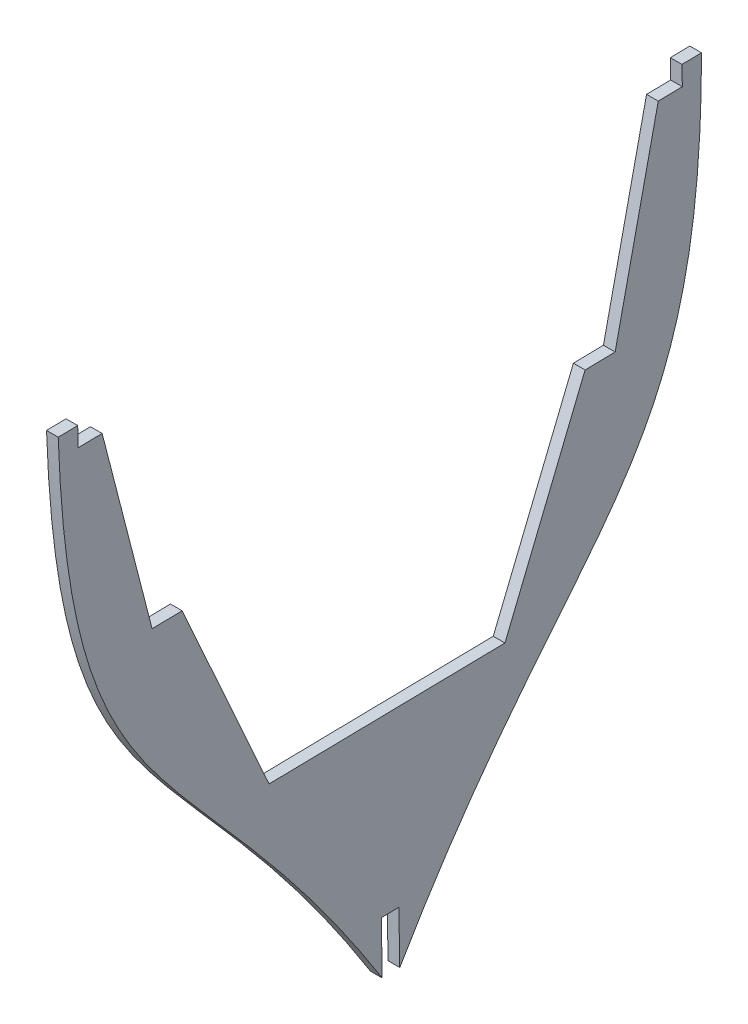
from build123d import *

# Parameters (mm, degrees)
BOSS_EXTRU_3_DEPTH      = 6
ENL_V_MAT_EXTRU_1_DEPTH = 6


with BuildPart() as part:
    # Esquisse2 → Boss.-Extru.3 (new body)
    with BuildSketch(Plane(origin=(0, 0, 0), x_dir=(0, 0, -1), z_dir=(1, 0, 0))):
        with BuildLine():
            Line((158.688577112, 362.336280449), (148.690113904, 362.160970799))
            Line((148.690113904, 362.160970799), (148.865423553, 352.162507591))
            Line((148.865423553, 352.162507591), (136.516792043, 351.945990891))
            Line((136.516792043, 351.945990891), (114.39634214, 251.542768174))
            Line((114.39634214, 251.542768174), (98.982631034, 251.272509411))
            Line((98.982631034, 251.272509411), (57.876642595, 150.536400726))
            Line((57.876642595, 150.536400726), (-63.118353192, 148.414915666))
            Line((-63.118353192, 148.414915666), (-107.730534624, 247.648071146))
            Line((-107.730534624, 247.648071146), (-123.144245729, 247.377812383))
            Line((-123.144245729, 247.377812383), (-148.770888625, 346.943853831))
            Line((-148.770888625, 346.943853831), (-161.119520136, 346.727337131))
            Line((-161.119520136, 346.727337131), (-161.294829786, 356.725800339))
            Line((-161.294829786, 356.725800339), (-171.293292994, 356.550490689))
            add(Edge.make_bspline(
                [(-171.293292994, 356.550490689), (-164.692148469, 168.366297569), (-100.837725638, 189.097977477), (-0.451034811, 25.723940294)],
                knots=[0, 0, 0, 0, 1, 1, 1, 1], degree=3))
            add(Edge.make_bspline(
                [(158.688577112, 362.336280449), (158.688577112, 174.036345108), (94.146622645, 192.516766653), (-0.451034811, 25.723940294)],
                knots=[0, 0, 0, 0, 1, 1, 1, 1], degree=3))
        make_face()
    extrude(amount=BOSS_EXTRU_3_DEPTH)

    # Esquisse3 → Enlèv. mat.-Extru.1 (cut)
    with BuildSketch(Plane(origin=(6, 0, 0), x_dir=(0, 0, -1), z_dir=(1, 0, 0))):
        Polygon((-5.082340683, 33.173281372), (-5.555676738, 60.169132034), (3.44294015, 60.326910718), (3.916276204, 33.331060056), (20.427860448, 15.824293167), (-15.868121038, 12.690499762), align=None)
    extrude(amount=-ENL_V_MAT_EXTRU_1_DEPTH, mode=Mode.SUBTRACT)


solid = part.part
